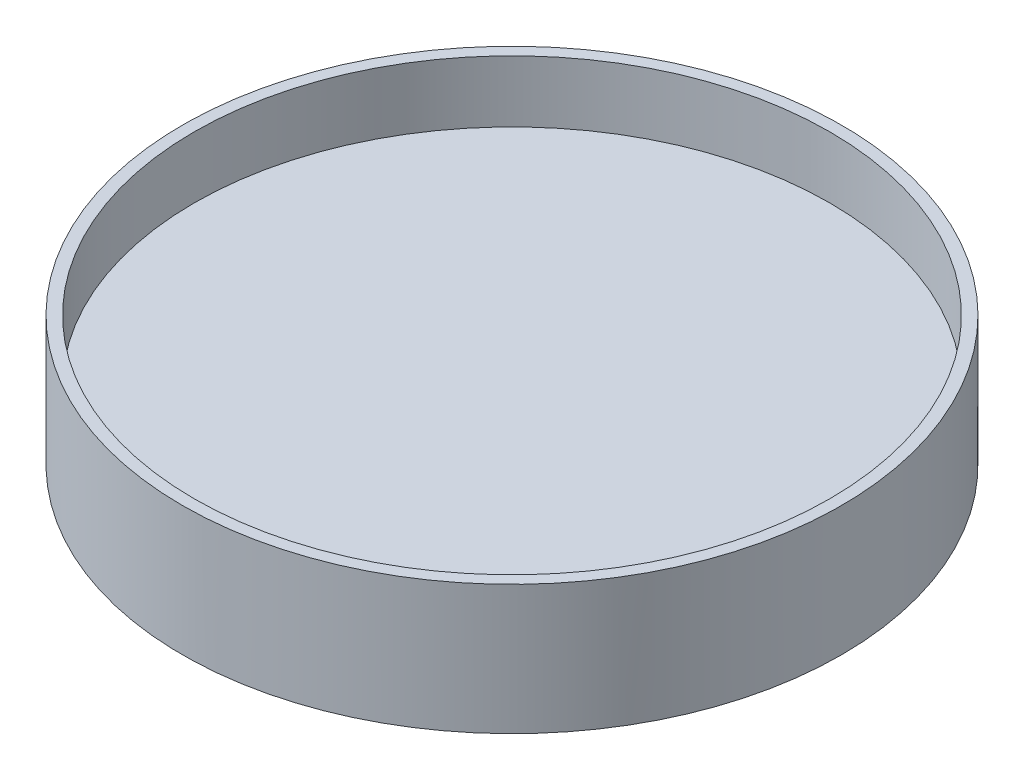
from build123d import *

# Parameters (mm, degrees)
SKETCH1_R           = 53.5
BOSS_EXTRUDE1_DEPTH = 2
SKETCH2_R           = 53.5
SKETCH2_R_2         = 51.6
BOSS_EXTRUDE2_DEPTH = 10
BOSS_EXTRUDE3_START = 9
SKETCH4_R           = 53.5
BOSS_EXTRUDE3_DEPTH = 9
SKETCH6_W           = 36
SKETCH6_H           = 36
CUT_EXTRUDE1_DEPTH  = 6.5
DRAFT4_START        = -19
DRAFT4_DEPTH        = 37
DRAFT4_2_DEPTH      = 38
CUT_EXTRUDE2_DEPTH  = 40.5
SKETCH14_R          = 2.35
CUT_EXTRUDE3_DEPTH  = 4


with BuildPart() as part:
    # Sketch1 → Boss-Extrude1 (new body)
    with BuildSketch(Plane(origin=(0, 0, 0), x_dir=(1, 0, 0), z_dir=(0, 1, 0))):
        with Locations(Location((0, 0, 0), (0, 0, 270))):
            Circle(SKETCH1_R)
    extrude(amount=BOSS_EXTRUDE1_DEPTH)

    # Sketch2 → Boss-Extrude2 (add)
    with BuildSketch(Plane(origin=(0, 2, 0), x_dir=(1, 0, 0), z_dir=(0, 1, 0))):
        with Locations(Location((0, 0, 0), (0, 0, 270))):
            Circle(SKETCH2_R)
        with Locations(Location((0, 0, 0), (0, 0, 270))):
            Circle(SKETCH2_R_2, mode=Mode.SUBTRACT)
    extrude(amount=BOSS_EXTRUDE2_DEPTH)

    # Sketch4 → Boss-Extrude3 (add)
    with BuildSketch(Plane.XZ.offset(BOSS_EXTRUDE3_START)):
        with Locations(Location((0, 0, 0), (0, 0, 270))):
            Circle(SKETCH4_R)
    extrude(amount=-BOSS_EXTRUDE3_DEPTH)

    # Sketch6 → Cut-Extrude1 (cut)
    with BuildSketch(Plane.XZ.offset(9)):
        Rectangle(SKETCH6_W, SKETCH6_H)
    extrude(amount=-CUT_EXTRUDE1_DEPTH, mode=Mode.SUBTRACT)

    # Draft4: read off the stored shape, not the designer's step
    # Draft4 outline → Draft4 (add)
    with BuildSketch(Plane.XY.offset(DRAFT4_START)):
        Polygon((18, -9), (18, -2.5), (15.634193477, -9), align=None)
        Polygon((-18, -9), (-15.634193477, -9), (-18, -2.5), align=None)
    extrude(amount=DRAFT4_DEPTH)

    # Draft4 2 outline → Draft4 2 (add)
    with BuildSketch(Plane.YZ.offset(DRAFT4_START)):
        Polygon((-9, 18), (-9, 15.634193477), (-2.5, 18), align=None)
    extrude(amount=DRAFT4_2_DEPTH)

    # Sketch13 → Cut-Extrude2 (cut)
    with BuildSketch(Plane.XY.offset(-18)):
        Polygon((15.634193477, -9), (-15.634193477, -9), (-18, -2.5), (18, -2.5), align=None)
    extrude(amount=-CUT_EXTRUDE2_DEPTH, mode=Mode.SUBTRACT)

    # Sketch14 → Cut-Extrude3 (cut)
    with BuildSketch(Plane.XZ.offset(2.5)):
        with Locations(Location((0, -37, 0), (0, 0, 270))):
            Circle(SKETCH14_R)
    extrude(amount=-CUT_EXTRUDE3_DEPTH, mode=Mode.SUBTRACT)


solid = part.part
